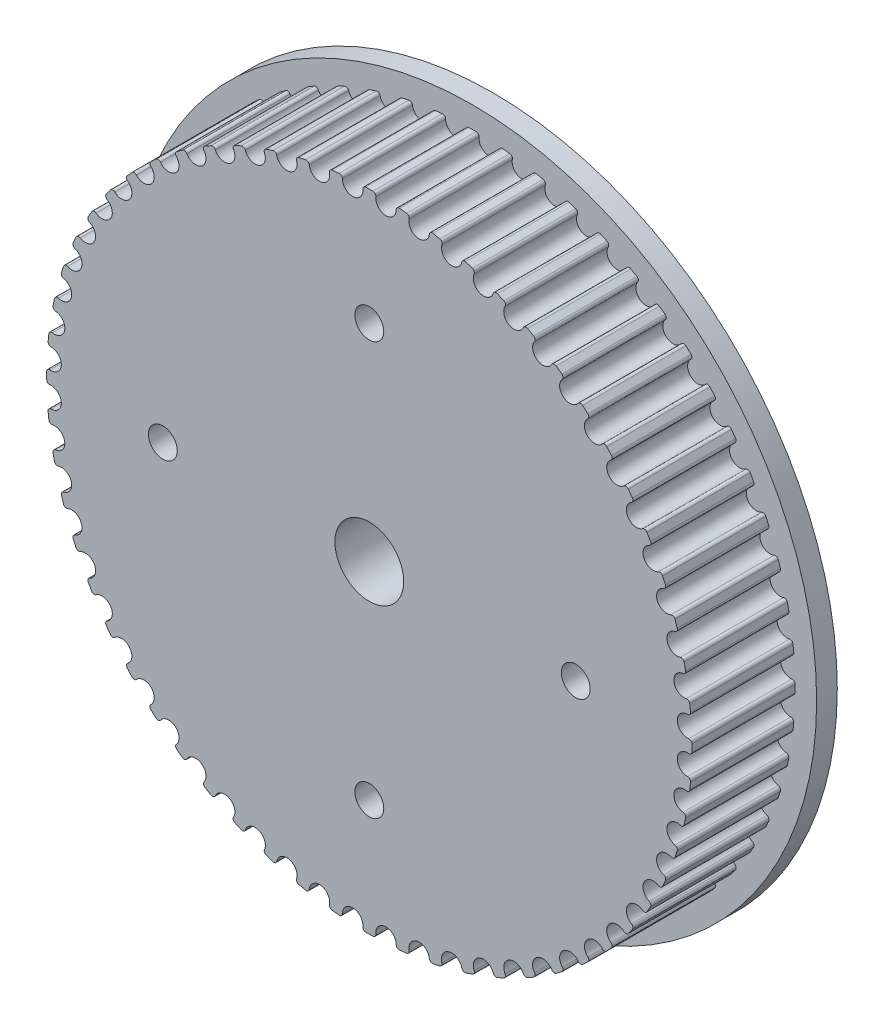
from build123d import *

# Parameters (mm, degrees)
SKETCH2_R               = 47.746482928
PD_DEPTH                = 7.5
TEETH_DEPTH             = 15
CIRPATTERN1_COUNT       = 60
SKETCH10_R              = 50
BOSS_EXTRUDE1_DEPTH     = 3
BOSS_EXTRUDE3_DEPTH     = 15
SKETCH15_R              = 13.5
BOSS_EXTRUDE4_DEPTH     = 3
CUT_EXTRUDE5_DEPTH      = 80.347337699
CUT_EXTRUDE5_DEPTH_BACK = 80.347337699
SKETCH16_R              = 5
CUT_EXTRUDE6_DEPTH      = 80.347337699
CUT_EXTRUDE6_DEPTH_BACK = 80.347337699
SKETCH17_R              = 2.1
SKETCH18_R              = 3.85
CUT_EXTRUDE7_DEPTH      = 6


with BuildPart() as part:
    # Sketch2 → PD (new, symmetric)
    with BuildSketch(Plane.XY):
        Circle(SKETCH2_R)
    extrude(amount=PD_DEPTH, both=True)

    # Sketch3 → Teeth (cut)
    with BuildSketch(Plane.XY.offset(7.5)):
        with BuildLine():
            Line((0, 46.876482928), (0.514304852, 46.876482928))
            ThreePointArc((0.514304852, 46.876482928), (0.834065512, 46.733977485), (0.941883686, 46.400916046))
            ThreePointArc((0.941883686, 46.400916046), (2.345513489, 44.755063495), (3.9134925, 46.245180627))
            ThreePointArc((3.9134925, 46.245180627), (4.055534435, 46.565147452), (4.388439288, 46.673448145))
            Line((4.388439288, 46.673448145), (4.899926724, 46.619688649))
            Line((4.899926724, 46.619688649), (4.990866487, 47.484922698))
            ThreePointArc((4.990866487, 47.484922698), (2.498857841, 47.681048032), (0, 47.746482928))
            Line((0, 47.746482928), (0, 46.876482928))
        make_face()
    teeth = extrude(amount=-TEETH_DEPTH, mode=Mode.SUBTRACT)

    # CirPattern1: Teeth ×60 about axis
    cirpattern1_axis = Axis((0, 0, 0), (0, 0, 1))
    for i in range(1, CIRPATTERN1_COUNT):
        add(teeth.rotate(cirpattern1_axis, i * 360 / CIRPATTERN1_COUNT), mode=Mode.SUBTRACT)

    # Sketch10 → Boss-Extrude1 (add)
    with BuildSketch(Plane(origin=(0, 0, -7.5), x_dir=(-1, 0, 0), z_dir=(0, 0, -1))):
        Circle(SKETCH10_R)
    extrude(amount=BOSS_EXTRUDE1_DEPTH)

    # Sketch14 → Boss-Extrude3 (add)
    with BuildSketch(Plane(origin=(0, 0, -10.5), x_dir=(-1, 0, 0), z_dir=(0, 0, -1))):
        with BuildLine():
            Line((0.316515098, 11.862395447), (-0.316515098, 11.862395447))
            ThreePointArc((-0.316515098, 11.862395447), (-0.647632855, 11.706732887), (-0.739017413, 11.352446754))
            ThreePointArc((-0.739017413, 11.352446754), (-1.912352484, 9.614045167), (-3.661630227, 10.77110292))
            ThreePointArc((-3.661630227, 10.77110292), (-3.881637984, 11.063449271), (-4.247120385, 11.080549445))
            Line((-4.247120385, 11.080549445), (-4.831964027, 10.838299276))
            ThreePointArc((-4.831964027, 10.838299276), (-5.078307463, 10.567772543), (-5.027156352, 10.20548348))
            ThreePointArc((-5.027156352, 10.20548348), (-5.445919123, 8.150393942), (-7.504827858, 8.549956307))
            ThreePointArc((-7.504827858, 8.549956307), (-7.819964626, 8.735855794), (-8.16417029, 8.611790234))
            Line((-8.16417029, 8.611790234), (-8.611790234, 8.16417029))
            ThreePointArc((-8.611790234, 8.16417029), (-8.735855794, 7.819964626), (-8.549956307, 7.504827858))
            ThreePointArc((-8.549956307, 7.504827858), (-8.150393942, 5.445919123), (-10.20548348, 5.027156352))
            ThreePointArc((-10.20548348, 5.027156352), (-10.567772543, 5.078307463), (-10.838299276, 4.831964027))
            Line((-10.838299276, 4.831964027), (-11.080549445, 4.247120385))
            ThreePointArc((-11.080549445, 4.247120385), (-11.063449271, 3.881637984), (-10.77110292, 3.661630227))
            ThreePointArc((-10.77110292, 3.661630227), (-9.614045167, 1.912352484), (-11.352446754, 0.739017413))
            ThreePointArc((-11.352446754, 0.739017413), (-11.706732887, 0.647632855), (-11.862395447, 0.316515098))
            Line((-11.862395447, 0.316515098), (-11.862395447, -0.316515098))
            ThreePointArc((-11.862395447, -0.316515098), (-11.706732887, -0.647632855), (-11.352446754, -0.739017413))
            ThreePointArc((-11.352446754, -0.739017413), (-9.614045167, -1.912352484), (-10.77110292, -3.661630227))
            ThreePointArc((-10.77110292, -3.661630227), (-11.063449271, -3.881637984), (-11.080549445, -4.247120385))
            Line((-11.080549445, -4.247120385), (-10.838299276, -4.831964027))
            ThreePointArc((-10.838299276, -4.831964027), (-10.567772543, -5.078307463), (-10.20548348, -5.027156352))
            ThreePointArc((-10.20548348, -5.027156352), (-8.150393942, -5.445919123), (-8.549956307, -7.504827858))
            ThreePointArc((-8.549956307, -7.504827858), (-8.735855794, -7.819964626), (-8.611790234, -8.16417029))
            Line((-8.611790234, -8.16417029), (-8.16417029, -8.611790234))
            ThreePointArc((-8.16417029, -8.611790234), (-7.819964626, -8.735855794), (-7.504827858, -8.549956307))
            ThreePointArc((-7.504827858, -8.549956307), (-5.445919123, -8.150393942), (-5.027156352, -10.20548348))
            ThreePointArc((-5.027156352, -10.20548348), (-5.078307463, -10.567772543), (-4.831964027, -10.838299276))
            Line((-4.831964027, -10.838299276), (-4.247120385, -11.080549445))
            ThreePointArc((-4.247120385, -11.080549445), (-3.881637984, -11.063449271), (-3.661630227, -10.77110292))
            ThreePointArc((-3.661630227, -10.77110292), (-1.912352484, -9.614045167), (-0.739017413, -11.352446754))
            ThreePointArc((-0.739017413, -11.352446754), (-0.647632855, -11.706732887), (-0.316515098, -11.862395447))
            Line((-0.316515098, -11.862395447), (0.316515098, -11.862395447))
            ThreePointArc((0.316515098, -11.862395447), (0.647632855, -11.706732887), (0.739017413, -11.352446754))
            ThreePointArc((0.739017413, -11.352446754), (1.912352484, -9.614045167), (3.661630227, -10.77110292))
            ThreePointArc((3.661630227, -10.77110292), (3.881637984, -11.063449271), (4.247120385, -11.080549445))
            Line((4.247120385, -11.080549445), (4.831964027, -10.838299276))
            ThreePointArc((4.831964027, -10.838299276), (5.078307463, -10.567772543), (5.027156352, -10.20548348))
            ThreePointArc((5.027156352, -10.20548348), (5.445919123, -8.150393942), (7.504827858, -8.549956307))
            ThreePointArc((7.504827858, -8.549956307), (7.819964626, -8.735855794), (8.16417029, -8.611790234))
            Line((8.16417029, -8.611790234), (8.611790234, -8.16417029))
            ThreePointArc((8.611790234, -8.16417029), (8.735855794, -7.819964626), (8.549956307, -7.504827858))
            ThreePointArc((8.549956307, -7.504827858), (8.150393942, -5.445919123), (10.20548348, -5.027156352))
            ThreePointArc((10.20548348, -5.027156352), (10.567772543, -5.078307463), (10.838299276, -4.831964027))
            Line((10.838299276, -4.831964027), (11.080549445, -4.247120385))
            ThreePointArc((11.080549445, -4.247120385), (11.063449271, -3.881637984), (10.77110292, -3.661630227))
            ThreePointArc((10.77110292, -3.661630227), (9.614045167, -1.912352484), (11.352446754, -0.739017413))
            ThreePointArc((11.352446754, -0.739017413), (11.706732887, -0.647632855), (11.862395447, -0.316515098))
            Line((11.862395447, -0.316515098), (11.862395447, 0.316515098))
            ThreePointArc((11.862395447, 0.316515098), (11.706732887, 0.647632855), (11.352446754, 0.739017413))
            ThreePointArc((11.352446754, 0.739017413), (9.614045167, 1.912352484), (10.77110292, 3.661630227))
            ThreePointArc((10.77110292, 3.661630227), (11.063449271, 3.881637984), (11.080549445, 4.247120385))
            Line((11.080549445, 4.247120385), (10.838299276, 4.831964027))
            ThreePointArc((10.838299276, 4.831964027), (10.567772543, 5.078307463), (10.20548348, 5.027156352))
            ThreePointArc((10.20548348, 5.027156352), (8.150393942, 5.445919123), (8.549956307, 7.504827858))
            ThreePointArc((8.549956307, 7.504827858), (8.735855794, 7.819964626), (8.611790234, 8.16417029))
            Line((8.611790234, 8.16417029), (8.16417029, 8.611790234))
            ThreePointArc((8.16417029, 8.611790234), (7.819964626, 8.735855794), (7.504827858, 8.549956307))
            ThreePointArc((7.504827858, 8.549956307), (5.445919123, 8.150393942), (5.027156352, 10.20548348))
            ThreePointArc((5.027156352, 10.20548348), (5.078307463, 10.567772543), (4.831964027, 10.838299276))
            Line((4.831964027, 10.838299276), (4.247120385, 11.080549445))
            ThreePointArc((4.247120385, 11.080549445), (3.881637984, 11.063449271), (3.661630227, 10.77110292))
            ThreePointArc((3.661630227, 10.77110292), (1.912352484, 9.614045167), (0.739017413, 11.352446754))
            ThreePointArc((0.739017413, 11.352446754), (0.647632855, 11.706732887), (0.316515098, 11.862395447))
        make_face()
    extrude(amount=BOSS_EXTRUDE3_DEPTH)

    # Sketch15 → Boss-Extrude4 (add)
    with BuildSketch(Plane(origin=(0, 0, -25.5), x_dir=(-1, 0, 0), z_dir=(0, 0, -1))):
        Circle(SKETCH15_R)
    extrude(amount=BOSS_EXTRUDE4_DEPTH)

    # Sketch16 → Cut-Extrude5 (cut, two sides: drawn at the far end of the back side and taken through both)
    with BuildSketch(Plane(origin=(0, 0, -28.5), x_dir=(-1, 0, 0), z_dir=(0, 0, -1)).offset(-CUT_EXTRUDE5_DEPTH_BACK)):
        Circle(SKETCH16_R)
    extrude(amount=CUT_EXTRUDE5_DEPTH + CUT_EXTRUDE5_DEPTH_BACK, mode=Mode.SUBTRACT)

    # Sketch17 → Cut-Extrude6 (cut, two sides: drawn at the far end of the back side and taken through both)
    with BuildSketch(Plane.XY.offset(7.5).offset(-CUT_EXTRUDE6_DEPTH_BACK)):
        with Locations((0, 30)):
            Circle(SKETCH17_R)
        with Locations((30, 0)):
            Circle(SKETCH17_R)
        with Locations((0, -30)):
            Circle(SKETCH17_R)
        with Locations((-30, 0)):
            Circle(SKETCH17_R)
    extrude(amount=CUT_EXTRUDE6_DEPTH + CUT_EXTRUDE6_DEPTH_BACK, mode=Mode.SUBTRACT)

    # Sketch18 → Cut-Extrude7 (cut)
    with BuildSketch(Plane(origin=(0, 0, -10.5), x_dir=(-1, 0, 0), z_dir=(0, 0, -1))):
        with Locations((30, 0)):
            Circle(SKETCH18_R)
        with Locations((0, 30)):
            Circle(SKETCH18_R)
        with Locations((-30, 0)):
            Circle(SKETCH18_R)
        with Locations((0, -30)):
            Circle(SKETCH18_R)
    extrude(amount=-CUT_EXTRUDE7_DEPTH, mode=Mode.SUBTRACT)


solid = part.part
